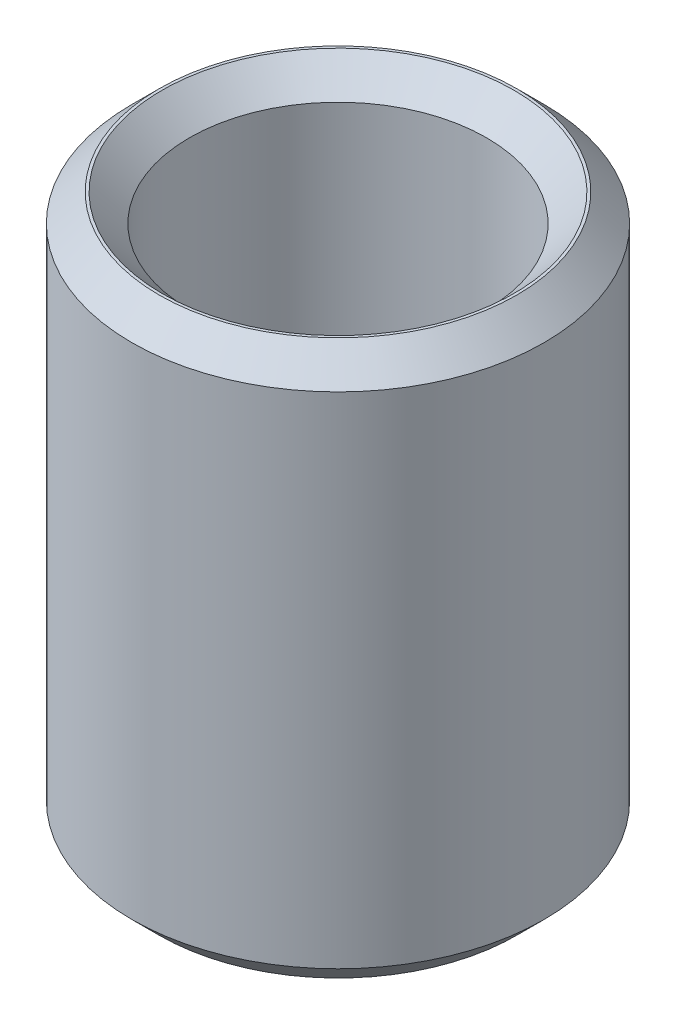
from build123d import *

# Parameters (mm, degrees)
SKETCH1_R           = 27.5
BOSS_EXTRUDE1_DEPTH = 73.934919907
SKETCH2_R           = 19.815680054
CUT_EXTRUDE1_DEPTH  = 84.539645568
CHAMFER1_SIZE       = 3.658916106


with BuildPart() as part:
    # Sketch1 → Boss-Extrude1 (new body)
    with BuildSketch(Plane(origin=(0, 0, 0), x_dir=(1, 0, 0), z_dir=(0, 1, 0))):
        Circle(SKETCH1_R)
    extrude(amount=BOSS_EXTRUDE1_DEPTH)

    # Sketch2 → Cut-Extrude1 (cut, through all)
    with BuildSketch(Plane(origin=(0, 0, 0), x_dir=(1, 0, 0), z_dir=(0, 1, 0))):
        Circle(SKETCH2_R)
    extrude(amount=CUT_EXTRUDE1_DEPTH, mode=Mode.SUBTRACT)

    # Chamfer1
    chamfer1_edges = [part.edges().sort_by_distance(p)[0] for p in [
        (-19.815680054, 73.934919907, 0),
        (-19.815680054, 0, 0),
        (-27.5, 0, 0),
        (-27.5, 73.934919907, 0),
    ]]
    chamfer(chamfer1_edges, length=CHAMFER1_SIZE)


solid = part.part
